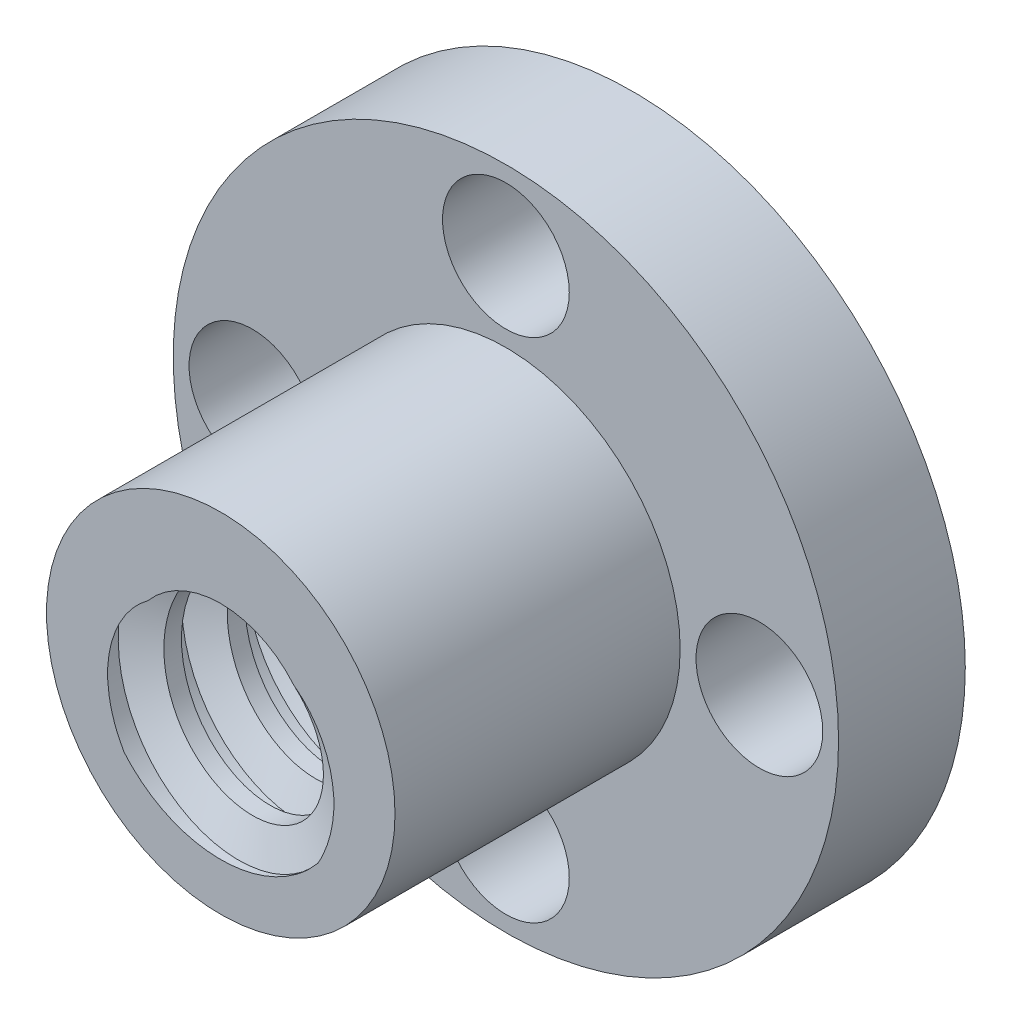
from build123d import *

# Parameters (mm, degrees)
CROQUIS1_R              = 10.5
CROQUIS1_R_2            = 3
CROQUIS1_R_3            = 2
SALIENTE_EXTRUIR1_DEPTH = 4
CROQUIS2_R              = 5.5
CROQUIS2_R_2            = 3
SALIENTE_EXTRUIR2_DEPTH = 9
CORTAR_BARRER1_PITCH    = 2


with BuildPart() as part:
    # Croquis1 → Saliente-Extruir1 (new body)
    with BuildSketch(Plane.XY):
        Circle(CROQUIS1_R)
        Circle(CROQUIS1_R_2, mode=Mode.SUBTRACT)
        with Locations((0, 8)):
            Circle(CROQUIS1_R_3, mode=Mode.SUBTRACT)
        with Locations((8, 0)):
            Circle(CROQUIS1_R_3, mode=Mode.SUBTRACT)
        with Locations((0, -8)):
            Circle(CROQUIS1_R_3, mode=Mode.SUBTRACT)
        with Locations((-8, 0)):
            Circle(CROQUIS1_R_3, mode=Mode.SUBTRACT)
    extrude(amount=SALIENTE_EXTRUIR1_DEPTH)

    # Croquis2 → Saliente-Extruir2 (add)
    with BuildSketch(Plane.XY.offset(4)):
        Circle(CROQUIS2_R)
        Circle(CROQUIS2_R_2, mode=Mode.SUBTRACT)
    extrude(amount=SALIENTE_EXTRUIR2_DEPTH)

    # Cortar-Barrer1: the profile of Croquis6 profile screwed along a right-hand helix of 9 turns, 10 arcs to a turn; built about Z, then put on its axis
    cortar_barrer1_z = Axis((0, 0, 0), (0, 0, 1))
    cortar_barrer1_corners = [(2.9997, 0, 0.722747911), (2.9997, 0, -0.722747911), (4, 0, -0.277385657), (4, 0, 0.277385657)]
    with BuildLine(mode=Mode.PRIVATE) as cortar_barrer1_profile:
        Line(cortar_barrer1_corners[0], cortar_barrer1_corners[1])
        Line(cortar_barrer1_corners[1], cortar_barrer1_corners[2])
        Line(cortar_barrer1_corners[2], cortar_barrer1_corners[3])
        Line(cortar_barrer1_corners[3], cortar_barrer1_corners[0])
    cortar_barrer1_cap = Face(cortar_barrer1_profile.wire())
    cortar_barrer1_turn_angles = [0, 18, 36, 54, 72, 90, 108, 126, 144, 162, 180, 198, 216, 234, 252, 270, 288, 306, 324, 342, 360]
    cortar_barrer1_turn_weights = [1, 0.9510565162951535, 1, 0.9510565162951535, 1, 0.9510565162951535, 1, 0.9510565162951535, 1, 0.9510565162951535, 1, 0.9510565162951535, 1, 0.9510565162951535, 1, 0.9510565162951535, 1, 0.9510565162951535, 1, 0.9510565162951535, 1]
    cortar_barrer1_turn_rails = [Edge.make_bspline([Vector(p[0], p[1], 0).rotate(cortar_barrer1_z, cortar_barrer1_turn_angles[k]) / cortar_barrer1_turn_weights[k] + Vector(0, 0, p[2] + CORTAR_BARRER1_PITCH * cortar_barrer1_turn_angles[k] / 360) for k in range(21)], [0, 0, 0, 1, 1, 2, 2, 3, 3, 4, 4, 5, 5, 6, 6, 7, 7, 8, 8, 9, 9, 10, 10, 10], 2, cortar_barrer1_turn_weights) for p in cortar_barrer1_corners]
    cortar_barrer1_turn_sides = [Face.make_surface_from_curves(cortar_barrer1_turn_rails[p[0]], cortar_barrer1_turn_rails[p[1]]) for p in [(0, 1), (1, 2), (2, 3), (3, 0)]]
    cortar_barrer1 = Plane(origin=(0, 0, -2), x_dir=(0, 1, 0), z_dir=(0, 0, 1)) * Solid(Shell([*[p.moved(Location((0, 0, CORTAR_BARRER1_PITCH * i))) for i in range(9) for p in cortar_barrer1_turn_sides], cortar_barrer1_cap, cortar_barrer1_cap.rotate(cortar_barrer1_z, 3240).moved(Location((0, 0, CORTAR_BARRER1_PITCH * 3240 / 360)))]))
    add(cortar_barrer1, mode=Mode.SUBTRACT)


solid = part.part
